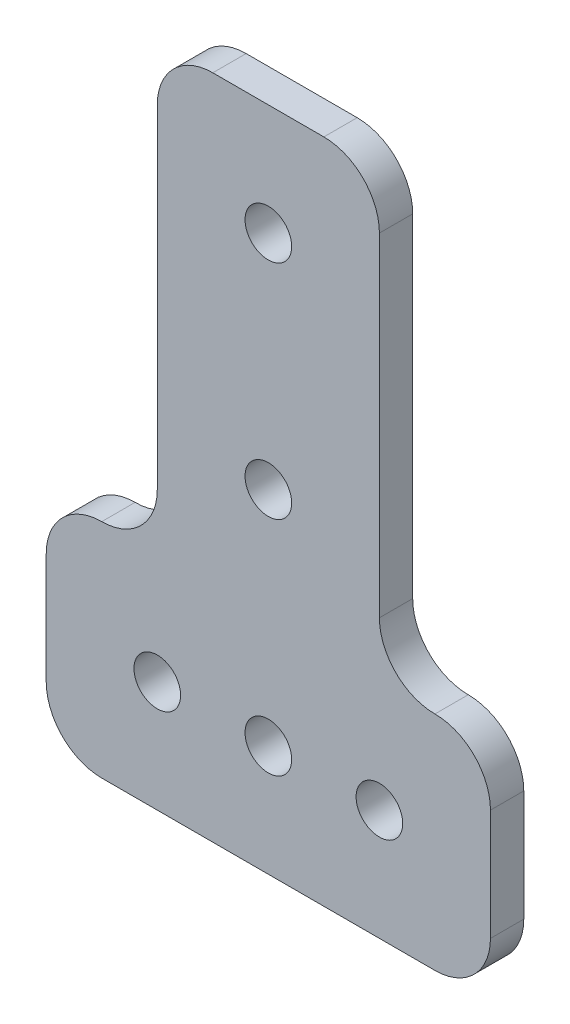
from build123d import *

# Parameters (mm, degrees)
SKETCH_1_R      = 2.1
EXTRUDE_1_DEPTH = 3
FILLET_1_R      = 5
FILLET_2_R      = 5


with BuildPart() as part:
    # 草图1 → 凸台-拉伸1 (new body)
    with BuildSketch(Plane.XY):
        Polygon((10, 0), (10, 40), (30, 40), (30, 0), (40, 0), (40, -20), (0, -20), (0, 0), align=None)
        with Locations((20, -10)):
            Circle(SKETCH_1_R, mode=Mode.SUBTRACT)
        with Locations((10, -10)):
            Circle(SKETCH_1_R, mode=Mode.SUBTRACT)
        with Locations((30, -10)):
            Circle(SKETCH_1_R, mode=Mode.SUBTRACT)
        with Locations((20, 10)):
            Circle(SKETCH_1_R, mode=Mode.SUBTRACT)
        with Locations((20, 30)):
            Circle(SKETCH_1_R, mode=Mode.SUBTRACT)
    extrude(amount=EXTRUDE_1_DEPTH)

    # 圆角1
    fillet_1_edges = [part.edges().sort_by_distance(p)[0] for p in [
        (10, 40, 1.5),
        (30, 40, 1.5),
        (40, -20, 1.5),
        (40, 0, 1.5),
        (30, 0, 1.5),
        (10, 0, 1.5),
        (0, 0, 1.5),
    ]]
    fillet(fillet_1_edges, radius=FILLET_1_R - 0.0001)  # a hair under: the kernel refuses the full size

    # 圆角2
    fillet_2_edges = [part.edges().sort_by_distance(p)[0] for p in [
        (0, -20, 1.5),
    ]]
    fillet(fillet_2_edges, radius=FILLET_2_R)


solid = part.part
